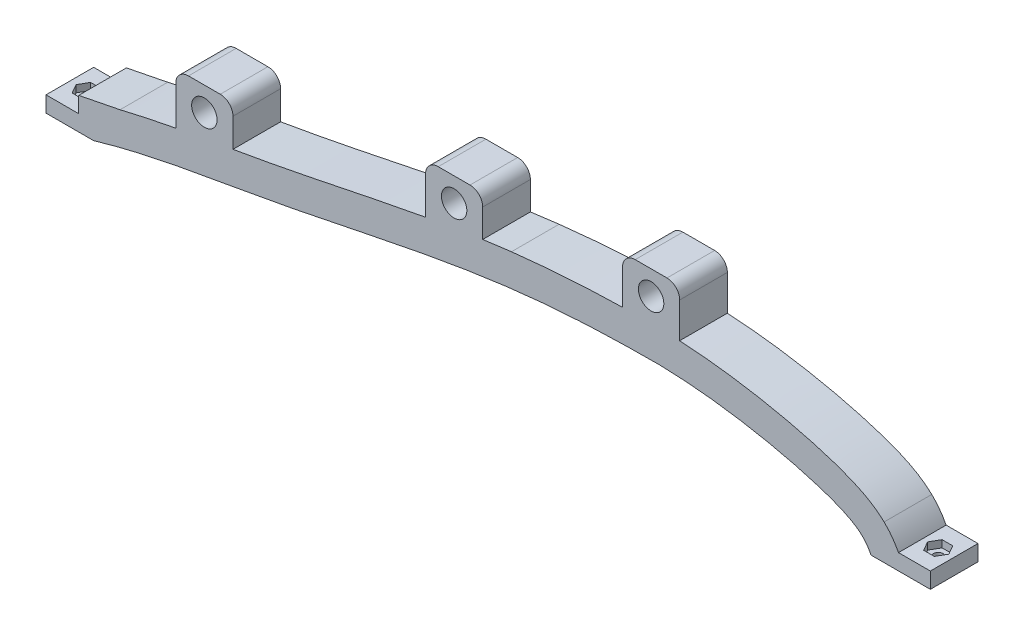
from build123d import *

# Parameters (mm, degrees)
BOSS_EXTRUDE14_DEPTH            = 15
SKETCH9_W                       = 10.305582395
SKETCH9_H                       = 5
BOSS_EXTRUDE15_DEPTH            = 15
BOSS_EXTRUDE16_START            = -15
BOSS_EXTRUDE16_OUTLINE_R        = 4
BOSS_EXTRUDE16_DEPTH            = 15
FILLET1_R                       = 4
CUT_EXTRUDE2_DEPTH              = 2.25
CUT_EXTRUDE3_DEPTH              = 2.25
F_3_0MM_DOWEL_HOLE1_D           = 3
F_3_0MM_DOWEL_HOLE1_CSINK_D     = 3.05
F_3_0MM_DOWEL_HOLE1_CSINK_ANGLE = 90
SKETCH16_R                      = 1.5
CUT_EXTRUDE4_DEPTH              = 265.853431953


# Read off the part's stored shape, not the designer's step: Boss-Extrude14, Boss-Extrude16
with BuildPart() as part:
    # Boss-Extrude14 outline → Boss-Extrude14 (new body)
    with BuildSketch(Plane(origin=(0, 0, -6), x_dir=(-1, 0, 0), z_dir=(0, 0, -1))):
        with BuildLine():
            Line((249.35, -9.718799499), (249.35, 0.281200501))
            Line((249.35, 0.281200501), (236.35, 2.868680647))
            add(Edge.make_bspline(
                [(113.156309789, 25.751987472), (114.460208978, 25.59959164), (120.100287856, 24.908577179), (128.609098159, 23.664110071), (140.134091586, 21.688830409), (153.008895552, 19.221496185), (168.538046321, 16.015172699), (182.477939999, 13.172125281), (193.559005245, 11.111240975), (201.981640704, 9.637661129), (210.486612866, 8.154956205), (219.063637957, 6.591746422), (227.68151116, 4.874943897), (233.474971, 3.568357951), (236.35, 2.868680647)],
                knots=[0.109458463, 0.109458463, 0.109458463, 0.109458463, 0.130371933, 0.200030506, 0.247022058, 0.318338141, 0.412321245, 0.506304349, 0.553295901, 0.600287453, 0.647279005, 0.694270557, 0.741262109, 0.788253661, 0.788253661, 0.788253661, 0.788253661], degree=3))
            add(Edge.make_bspline(
                [(76.45, 28.125418087), (94.882372903, 27.862574162), (113.156309789, 25.751987472)],
                knots=[0, 0, 0, 0.632722323, 0.632722323, 0.632722323], degree=2))
            add(Edge.make_bspline(
                [(66.284340587, 28.219952736), (67.129544996, 28.219602739), (68.818588071, 28.215923169), (71.36030606, 28.198672488), (73.903160315, 28.169538769), (75.601337427, 28.141603711), (76.45, 28.125418087)],
                knots=[0.875312122, 0.875312122, 0.875312122, 0.875312122, 0.888961276, 0.902610431, 0.916259586, 0.92990874, 0.92990874, 0.92990874, 0.92990874], degree=3))
            add(Edge.make_bspline(
                [(-4.147448422, 10.754973325), (-3.746592061, 11.135583203), (-2.910664688, 11.873123525), (-1.8664669, 12.676265805), (-1.020623492, 13.271741618), (-0.136993775, 13.859475937), (1.465019188, 14.831768722), (3.815921844, 16.045559455), (7.753628889, 17.758192835), (13.256195767, 19.698691993), (21.152959065, 21.952811545), (30.479838242, 24.122904012), (39.4239247, 25.749420494), (47.205771024, 26.831006606), (53.324700432, 27.499051298), (58.631201034, 27.906826379), (62.977570557, 28.125868706), (65.18464413, 28.194929818), (66.284340587, 28.219952736)],
                knots=[0.135157363, 0.135157363, 0.135157363, 0.135157363, 0.162214964, 0.189272566, 0.201061372, 0.214590172, 0.243387768, 0.297502971, 0.351618174, 0.459848579, 0.568078984, 0.676309389, 0.784539795, 0.838654997, 0.8927702, 0.946885402, 0.973943004, 1.001000605, 1.001000605, 1.001000605, 1.001000605], degree=3))
            add(Edge.make_bspline(
                [(-8.702959439, 4.575291566), (-6.890883257, 8.114910032), (-4.147448422, 10.754973325)],
                knots=[0, 0, 0, 0.636944249, 0.636944249, 0.636944249], degree=2))
            add(Edge.make_bspline(
                [(-8.702959439, 4.575291566), (-8.771267052, 4.454592439), (-8.899970783, 4.219174636), (-9.174274638, 3.674724808), (-9.523622742, 2.874059155), (-9.910621046, 1.66916954), (-10.123727188, 0.514933148), (-10.179306724, -0.189247064), (-10.188216911, -0.35)],
                knots=[0, 0, 0, 0, 0.000508489, 0.001016978, 0.002033955, 0.003050933, 0.00394155, 0.004195794, 0.004195794, 0.004195794, 0.004195794], degree=3))
            Line((-10.188216911, -0.35), (0, -0.35))
            add(Edge.make_bspline(
                [(0, -0.35), (3.178862469, 6.495343287), (8.987756305, 8.032168144), (22.140633739, 13.071207305), (43.250433247, 17.69324185), (66.39602757, 18.219905629)],
                knots=[0, 0, 0, 0, 0, 0, 1, 1, 1, 1, 1, 1], degree=5))
            add(Edge.make_bspline(
                [(66.39602757, 18.219905629), (73.079858249, 18.217137873), (79.768873399, 18.101745103), (86.45, 17.815976098)],
                knots=[0.875945967, 0.875945967, 0.875945967, 0.875945967, 0.985673704, 0.985673704, 0.985673704, 0.985673704], degree=3))
            Line((86.45, 17.815976098), (89.45, 17.675984992))
            ThreePointArc((89.45, 17.675984992), (90.756210616, 17.607556707), (92.062168571, 17.534464817))
            add(Edge.make_bspline(
                [(92.062168571, 17.534464817), (95.665977641, 17.334138157), (108.464938821, 16.428798519), (140.620964858, 12.117510077), (187.478425037, 1.167330167), (226.131267819, -4.204534739), (244.655582392, -9.718799508)],
                knots=[0, 0, 0, 0, 0.05922822, 0.210539222, 0.531730365, 0.848733007, 0.848733007, 0.848733007, 0.848733007], degree=3))
            Line((244.655582392, -9.718799508), (249.35, -9.718799499))
        make_face()
    extrude(amount=BOSS_EXTRUDE14_DEPTH)

    # Sketch9 → Boss-Extrude15 (add)
    with BuildSketch(Plane.XY.offset(-6)):
        with BuildLine():
            add(Edge.make_bspline(
                [(8.702959439, 4.575291566), (8.771267052, 4.454592439), (8.899970783, 4.219174636), (9.174274638, 3.674724808), (9.523622742, 2.874059155), (9.910621046, 1.66916954), (10.123727188, 0.514933148), (10.179306724, -0.189247064), (10.188216911, -0.35)],
                knots=[0, 0, 0, 0, 0.000508489, 0.001016978, 0.002033955, 0.003050933, 0.00394155, 0.004195794, 0.004195794, 0.004195794, 0.004195794], degree=3))
            Line((10.188216911, -0.35), (18.69, -0.35))
            Line((18.69, -0.35), (18.69, 4.65))
            Line((18.69, 4.65), (8.664557691, 4.65))
            add(Edge.make_bspline(
                [(8.702959439, 4.575291566), (8.683810567, 4.612696009), (8.664557691, 4.65)],
                knots=[0, 0, 0, 0.006730823, 0.006730823, 0.006730823], degree=2))
        make_face()
        with Locations((-254.502791198, -7.218799499)):
            Rectangle(SKETCH9_W, SKETCH9_H)
    extrude(amount=-BOSS_EXTRUDE15_DEPTH)

    # Boss-Extrude16 outline → Boss-Extrude16 (add)
    # profile 1 of 3: a face of its own
    with BuildSketch(Plane.XY.offset(-6).offset(BOSS_EXTRUDE16_START)):
        with BuildLine():
            add(Edge.make_bspline(
                [(-200.81, 9.843246703), (-201.204842604, 9.774216263), (-204.419312994, 9.212692224), (-210.400725126, 8.169929349), (-216.031409877, 7.144376286), (-218.81, 6.615762453)],
                knots=[0.593701678, 0.593701678, 0.593701678, 0.593701678, 0.600287453, 0.647279005, 0.69284692, 0.69284692, 0.69284692, 0.69284692], degree=3))
            Line((-200.81, 9.843246703), (-200.81, 22.86245595))
            Line((-200.81, 22.86245595), (-218.81, 22.86245595))
            Line((-218.81, 22.86245595), (-218.81, 6.615762453))
        make_face()
        with Locations((-209.81, 15.36245595)):
            Circle(BOSS_EXTRUDE16_OUTLINE_R, mode=Mode.SUBTRACT)
    # profile 2 of 3: a face of its own
    with BuildSketch(Plane.XY.offset(-6).offset(BOSS_EXTRUDE16_START)):
        with BuildLine():
            add(Edge.make_bspline(
                [(-122.199999995, 24.58006078), (-124.804407306, 24.210507661), (-130.301243555, 23.374091651), (-136.28735582, 22.348126136), (-139.677142176, 21.735093133), (-140.2, 21.639813309)],
                knots=[0.15796988, 0.15796988, 0.15796988, 0.15796988, 0.200030506, 0.247022058, 0.255600029, 0.255600029, 0.255600029, 0.255600029], degree=3))
            Line((-122.199999995, 24.58006078), (-122.2, 37.420573855))
            Line((-122.2, 37.420573855), (-140.2, 37.420573855))
            Line((-140.2, 37.420573855), (-140.2, 21.639813309))
        make_face()
        with Locations((-131.2, 29.920573855)):
            Circle(BOSS_EXTRUDE16_OUTLINE_R, mode=Mode.SUBTRACT)
    # profile 3 of 3: a face of its own
    with BuildSketch(Plane.XY.offset(-6).offset(BOSS_EXTRUDE16_START)):
        with BuildLine():
            Line((-60.199999997, 27.980034372), (-60.2, 43.08620947))
            Line((-60.2, 43.08620947), (-78.2, 43.08620947))
            Line((-78.2, 43.08620947), (-78.199999995, 28.096292606))
            add(Edge.make_bspline(
                [(-76.45, 28.125418087), (-77.325178587, 28.112938121), (-78.199999995, 28.096292606)],
                knots=[0, 0, 0, 0.030041983, 0.030041983, 0.030041983], degree=2))
            add(Edge.make_bspline(
                [(-66.284340587, 28.219952736), (-67.129544996, 28.219602739), (-68.818588071, 28.215923169), (-71.36030606, 28.198672488), (-73.903160315, 28.169538769), (-75.601337427, 28.141603711), (-76.45, 28.125418087)],
                knots=[0.875312122, 0.875312122, 0.875312122, 0.875312122, 0.888961276, 0.902610431, 0.916259586, 0.92990874, 0.92990874, 0.92990874, 0.92990874], degree=3))
            add(Edge.make_bspline(
                [(-60.199999997, 27.980034372), (-61.122523668, 28.03215495), (-63.139027933, 28.130920838), (-65.18464413, 28.194929818), (-66.284340587, 28.219952736)],
                knots=[0.950844173, 0.950844173, 0.950844173, 0.950844173, 0.973943004, 1.001000605, 1.001000605, 1.001000605, 1.001000605], degree=3))
        make_face()
        with Locations((-69.2, 35.58620947)):
            Circle(BOSS_EXTRUDE16_OUTLINE_R, mode=Mode.SUBTRACT)
    extrude(amount=BOSS_EXTRUDE16_DEPTH)

    # Fillet1
    fillet1_edges = [part.edges().sort_by_distance(p)[0] for p in [
        (-200.81, 22.86245595, -13.5),
        (-218.81, 22.86245595, -13.5),
        (-140.2, 37.420573855, -13.5),
        (-122.2, 37.420573855, -13.5),
        (-60.2, 43.08620947, -13.5),
        (-78.2, 43.08620947, -13.5),
    ]]
    fillet(fillet1_edges, radius=FILLET1_R)

    # Sketch12 → Cut-Extrude2 (cut)
    with BuildSketch(Plane(origin=(0, -4.718799499, 0), x_dir=(1, 0, 0), z_dir=(0, 1, 0))):
        with BuildLine():
            Line((-252.85, 13.5), (-251, 13.5))
            Line((-251, 13.5), (-252.672949017, 16.4))
            Line((-252.672949017, 16.4), (-256.027050983, 16.4))
            Line((-256.027050983, 16.4), (-257.7, 13.5))
            Line((-257.7, 13.5), (-255.85, 13.5))
            ThreePointArc((-255.85, 13.5), (-254.35, 15), (-252.85, 13.5))
        make_face()
        with BuildLine():
            Line((-252.672949017, 10.6), (-251, 13.5))
            Line((-251, 13.5), (-252.85, 13.5))
            ThreePointArc((-252.85, 13.5), (-254.35, 12), (-255.85, 13.5))
            Line((-255.85, 13.5), (-257.7, 13.5))
            Line((-257.7, 13.5), (-256.027050983, 10.6))
            Line((-256.027050983, 10.6), (-252.672949017, 10.6))
        make_face()
        with BuildLine():
            ThreePointArc((-255.85, 13.5), (-254.35, 12), (-252.85, 13.5))
            Line((-252.85, 13.5), (-254.35, 13.5))
            Line((-254.35, 13.5), (-255.85, 13.5))
        make_face()
    extrude(amount=-CUT_EXTRUDE2_DEPTH, mode=Mode.SUBTRACT)

    # Sketch14 → Cut-Extrude3 (cut)
    with BuildSketch(Plane(origin=(0, 4.65, 0), x_dir=(1, 0, 0), z_dir=(0, 1, 0))):
        with BuildLine():
            ThreePointArc((13.664557695, 15), (14.725217866, 14.560660172), (15.164557695, 13.5))
            Line((15.164557695, 13.5), (17.014557695, 13.5))
            Line((17.014557695, 13.5), (15.341608678, 16.4))
            Line((15.341608678, 16.4), (13.664557695, 16.4))
            Line((13.664557695, 16.4), (13.664557695, 15))
        make_face()
        with BuildLine():
            Line((10.314557695, 13.5), (12.164557695, 13.5))
            ThreePointArc((12.164557695, 13.5), (12.603897523, 14.560660172), (13.664557695, 15))
            Line((13.664557695, 15), (13.664557695, 16.4))
            Line((13.664557695, 16.4), (11.987506712, 16.4))
            Line((11.987506712, 16.4), (10.314557695, 13.5))
        make_face()
        with BuildLine():
            Line((11.987506712, 10.6), (13.664557695, 10.6))
            Line((13.664557695, 10.6), (13.664557695, 12))
            ThreePointArc((13.664557695, 12), (12.603897523, 12.439339828), (12.164557695, 13.5))
            Line((12.164557695, 13.5), (10.314557695, 13.5))
            Line((10.314557695, 13.5), (11.987506712, 10.6))
        make_face()
        with BuildLine():
            Line((13.664557695, 12), (13.664557695, 10.6))
            Line((13.664557695, 10.6), (15.341608678, 10.6))
            Line((15.341608678, 10.6), (17.014557695, 13.5))
            Line((17.014557695, 13.5), (15.164557695, 13.5))
            ThreePointArc((15.164557695, 13.5), (14.725217866, 12.439339828), (13.664557695, 12))
        make_face()
    extrude(amount=-CUT_EXTRUDE3_DEPTH, mode=Mode.SUBTRACT)

    # Ø3.0mm Dowel Hole1 (through all)
    with Locations(Plane(origin=(0, 4.65, 0), x_dir=(1, 0, 0), z_dir=(0, 1, 0))):
        with Locations((13.664557695, 13.5)):
            CounterSinkHole(F_3_0MM_DOWEL_HOLE1_D / 2, F_3_0MM_DOWEL_HOLE1_CSINK_D / 2, counter_sink_angle=F_3_0MM_DOWEL_HOLE1_CSINK_ANGLE)

    # Sketch16 → Cut-Extrude4 (cut, through all)
    with BuildSketch(Plane(origin=(0, -4.718799499, 0), x_dir=(1, 0, 0), z_dir=(0, 1, 0))):
        with Locations(Location((-254.35, 13.5, 0), (0, 0, 180))):
            Circle(SKETCH16_R)
    extrude(amount=-CUT_EXTRUDE4_DEPTH, mode=Mode.SUBTRACT)


solid = part.part
